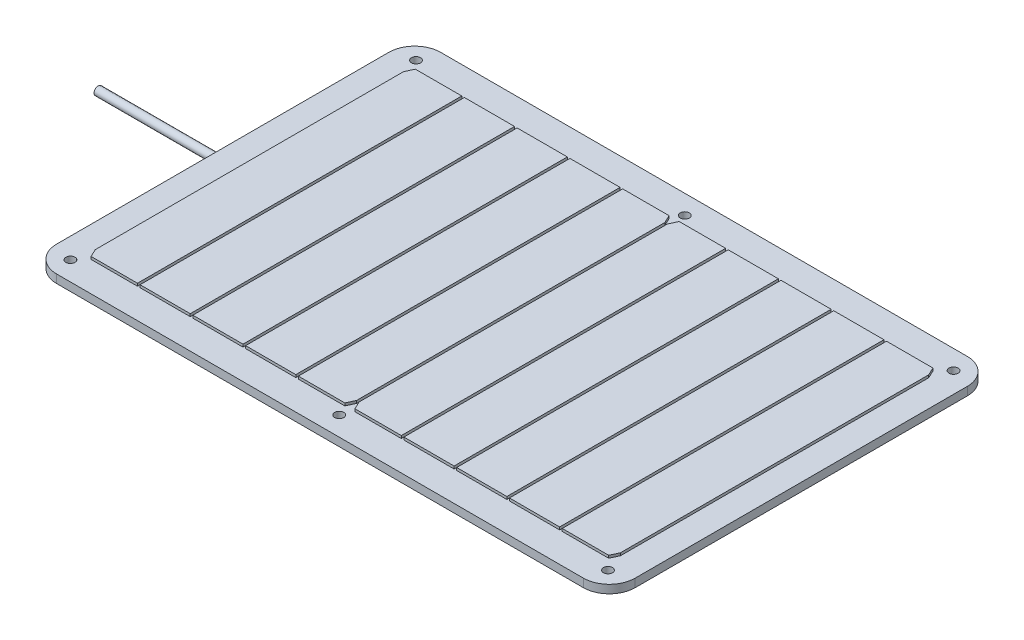
from build123d import *

# Parameters (mm, degrees)
BOSS_EXTRUDE1_DEPTH      = 3.2
BOSS_EXTRUDE2_DEPTH      = 5
FILLET1_R                = 5
BOSS_EXTRUDE5_DEPTH      = 48
BOSS_EXTRUDE5_DEPTH_BACK = 61.5
SKETCH3_R                = 1.6
SKETCH4_R                = 1.75
CUT_EXTRUDE2_DEPTH       = 177.021277123
SKETCH5_W                = 19.34
SKETCH5_H                = 125
BOSS_EXTRUDE6_DEPTH      = 1


with BuildPart() as part:
    # Sketch1 → Boss-Extrude1 (new body)
    with BuildSketch(Plane(origin=(0, 0, 0), x_dir=(1, 0, 0), z_dir=(0, 1, 0))):
        with BuildLine():
            Line((-101.5, 74), (101.5, 74))
            ThreePointArc((101.5, 74), (108.571067812, 71.071067812), (111.5, 64))
            Line((111.5, 64), (111.5, -64))
            ThreePointArc((111.5, -64), (108.571067812, -71.071067812), (101.5, -74))
            Line((101.5, -74), (-101.5, -74))
            ThreePointArc((-101.5, -74), (-108.571067812, -71.071067812), (-111.5, -64))
            Line((-111.5, -64), (-111.5, 64))
            ThreePointArc((-111.5, 64), (-108.571067812, 71.071067812), (-101.5, 74))
        make_face()
    extrude(amount=BOSS_EXTRUDE1_DEPTH)

    # Sketch2 → Boss-Extrude2 (add)
    with BuildSketch(Plane.XZ):
        with BuildLine():
            Line((-45, 15), (-25, 15))
            ThreePointArc((-25, 15), (-21.464466094, 13.535533906), (-20, 10))
            Line((-20, 10), (-20, -10))
            ThreePointArc((-20, -10), (-21.464466094, -13.535533906), (-25, -15))
            Line((-25, -15), (-45, -15))
            ThreePointArc((-45, -15), (-48.535533906, -13.535533906), (-50, -10))
            Line((-50, -10), (-50, 10))
            ThreePointArc((-50, 10), (-48.535533906, 13.535533906), (-45, 15))
        make_face()
    extrude(amount=BOSS_EXTRUDE2_DEPTH)

    # Fillet1
    fillet1_edges = [part.edges().sort_by_distance(p)[0] for p in [
        (-20, -5, 0),
        (-21.464466094, -5, -13.535533906),
        (-35, -5, -15),
        (-48.535533906, -5, -13.535533906),
        (-50, -5, 0),
        (-48.535533906, -5, 13.535533906),
        (-35, -5, 15),
        (-21.464466094, -5, 13.535533906),
    ]]
    fillet(fillet1_edges, radius=FILLET1_R - 0.0001)  # a hair under: the kernel refuses the full size

    # Sketch4 → Cut-Extrude2 (cut, through all)
    with BuildSketch(Plane(origin=(0, 3.2, 0), x_dir=(1, 0, 0), z_dir=(0, 1, 0))):
        with Locations(Location((-103.6, 66.6, 0), (0, 0, 270))):
            Circle(SKETCH4_R)
        with Locations(Location((0, 66.6, 0), (0, 0, 270))):
            Circle(SKETCH4_R)
        with Locations(Location((103.6, 66.6, 0), (0, 0, 270))):
            Circle(SKETCH4_R)
        with Locations(Location((0, -66.6, 0), (0, 0, 270))):
            Circle(SKETCH4_R)
        with Locations(Location((103.6, -66.6, 0), (0, 0, 270))):
            Circle(SKETCH4_R)
        with Locations(Location((-103.6, -66.6, 0), (0, 0, 270))):
            Circle(SKETCH4_R)
    extrude(amount=-CUT_EXTRUDE2_DEPTH, mode=Mode.SUBTRACT)

    # Sketch5 → Boss-Extrude6 (add)
    with BuildSketch(Plane(origin=(0, 3.2, 0), x_dir=(1, 0, 0), z_dir=(0, 1, 0))):
        with Locations((-50.85, 0)):
            Rectangle(SKETCH5_W, SKETCH5_H)
        Polygon((-99.752228661, 62.5), (-101.2, 59.395244345), (-101.2, -59.395244345), (-99.752228661, -62.5), (-81.86, -62.5), (-81.86, 62.5), align=None)
        with Locations((-71.19, 0)):
            Rectangle(SKETCH5_W, SKETCH5_H)
        with Locations((-30.51, 0)):
            Rectangle(SKETCH5_W, SKETCH5_H)
        Polygon((-1.947771339, -62.5), (-19.84, -62.5), (-19.84, 62.5), (-1.947771339, 62.5), (-0.5, 59.395244345), (-0.5, -59.395244345), align=None)
        with Locations((50.85, 0)):
            Rectangle(SKETCH5_W, SKETCH5_H)
        Polygon((1.947771339, 62.5), (0.5, 59.395244345), (0.5, -59.395244345), (1.947771339, -62.5), (19.84, -62.5), (19.84, 62.5), align=None)
        with Locations((30.51, 0)):
            Rectangle(SKETCH5_W, SKETCH5_H)
        with Locations((71.19, 0)):
            Rectangle(SKETCH5_W, SKETCH5_H)
        Polygon((99.752228661, -62.5), (81.86, -62.5), (81.86, 62.5), (99.752228661, 62.5), (101.2, 59.395244345), (101.2, -59.395244345), align=None)
    extrude(amount=BOSS_EXTRUDE6_DEPTH)


with BuildPart() as body_2:
    # Sketch3 → Boss-Extrude5 (new, two sides: drawn at the far end of the back side and taken through both)
    with BuildSketch(Plane.ZY.offset(111.5).offset(-BOSS_EXTRUDE5_DEPTH_BACK)):
        with Locations((0, -1.6)):
            Circle(SKETCH3_R)
    extrude(amount=BOSS_EXTRUDE5_DEPTH + BOSS_EXTRUDE5_DEPTH_BACK)


solid = Compound([part.part, body_2.part])
